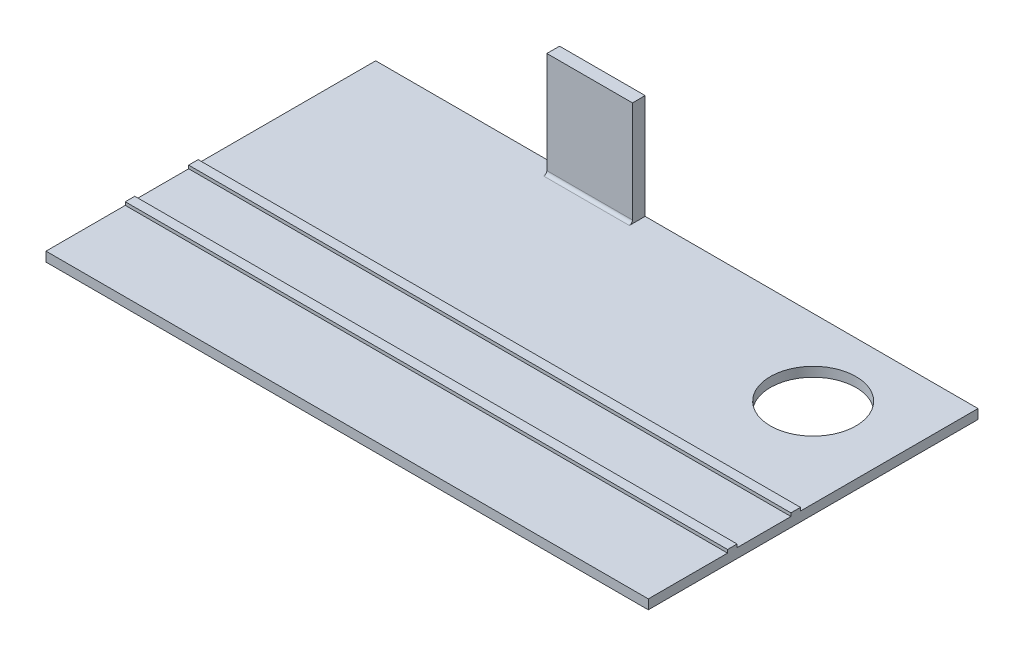
from build123d import *

# Parameters (mm, degrees)
SCHIZZO1_W                        = 27
SCHIZZO1_H                        = 36
ESTRUSIONE_ESTRUSIONE1_DEPTH      = 4
SCHIZZO3_W                        = 27
SCHIZZO3_H                        = 3
ESTRUSIONE_ESTRUSIONE2_DEPTH      = 100
RACCORDO1_R                       = 1
ESTRUSIONE_ESTRUSIONE3_DEPTH      = 170
ESTRUSIONE_ESTRUSIONE3_DEPTH_BACK = 150
SCHIZZO5_W                        = 104
SCHIZZO5_H                        = 3
SCHIZZO6_W                        = 3
SCHIZZO6_H                        = 1
ESTRUSIONE_ESTRUSIONE4_DEPTH      = 320
TAGLIO_ESTRUSIONE1_DEPTH          = 10
TAGLIO_ESTRUSIONE1_DEPTH_BACK     = 10
SCHIZZO7_W                        = 65
SCHIZZO7_H                        = 104
SCHIZZO8_R                        = 13.5
TAGLIO_ESTRUSIONE2_DEPTH          = 10


with BuildPart() as part:
    # Schizzo1 → Estrusione-Estrusione1 (new body)
    with BuildSketch(Plane.XY):
        with Locations((13.5, -18)):
            Rectangle(SCHIZZO1_W, SCHIZZO1_H)
    extrude(amount=ESTRUSIONE_ESTRUSIONE1_DEPTH)

    # Schizzo3 → Estrusione-Estrusione2 (add)
    with BuildSketch(Plane.XY.offset(4)):
        with Locations((13.5, -34.5)):
            Rectangle(SCHIZZO3_W, SCHIZZO3_H)
    extrude(amount=ESTRUSIONE_ESTRUSIONE2_DEPTH)

    # Raccordo1
    raccordo1_edges = [part.edges().sort_by_distance(p)[0] for p in [
        (13.5, -33, 4),
    ]]
    fillet(raccordo1_edges, radius=RACCORDO1_R)

    # Schizzo5 → Estrusione-Estrusione3 (add, two sides: drawn at the far end of the back side and taken through both)
    with BuildSketch(Plane(origin=(27, 0, 0), x_dir=(0, 0, -1), z_dir=(1, 0, 0)).offset(-ESTRUSIONE_ESTRUSIONE3_DEPTH_BACK)):
        with Locations((-52, -34.5)):
            Rectangle(SCHIZZO5_W, SCHIZZO5_H)
    extrude(amount=ESTRUSIONE_ESTRUSIONE3_DEPTH + ESTRUSIONE_ESTRUSIONE3_DEPTH_BACK)

    # Schizzo6 → Estrusione-Estrusione4 (add)
    with BuildSketch(Plane.ZY.offset(123)):
        with Locations((77.5, -32.5)):
            Rectangle(SCHIZZO6_W, SCHIZZO6_H)
        with Locations((57.5, -32.5)):
            Rectangle(SCHIZZO6_W, SCHIZZO6_H)
    extrude(amount=-ESTRUSIONE_ESTRUSIONE4_DEPTH)

    # Schizzo7 → Taglio-Estrusione1 (cut, two sides: drawn at the far end of the back side and taken through both)
    with BuildSketch(Plane(origin=(0, -33, 0), x_dir=(1, 0, 0), z_dir=(0, 1, 0)).offset(-TAGLIO_ESTRUSIONE1_DEPTH_BACK)):
        with Locations((-90.5, -52)):
            Rectangle(SCHIZZO7_W, SCHIZZO7_H)
        with Locations((164.5, -52)):
            Rectangle(SCHIZZO7_W, SCHIZZO7_H)
    extrude(amount=TAGLIO_ESTRUSIONE1_DEPTH + TAGLIO_ESTRUSIONE1_DEPTH_BACK, mode=Mode.SUBTRACT)

    # Schizzo8 → Taglio-Estrusione2 (cut)
    with BuildSketch(Plane(origin=(0, -33, 0), x_dir=(1, 0, 0), z_dir=(0, 1, 0))):
        with Locations((104, -24)):
            Circle(SCHIZZO8_R)
    extrude(amount=-TAGLIO_ESTRUSIONE2_DEPTH, mode=Mode.SUBTRACT)


solid = part.part
